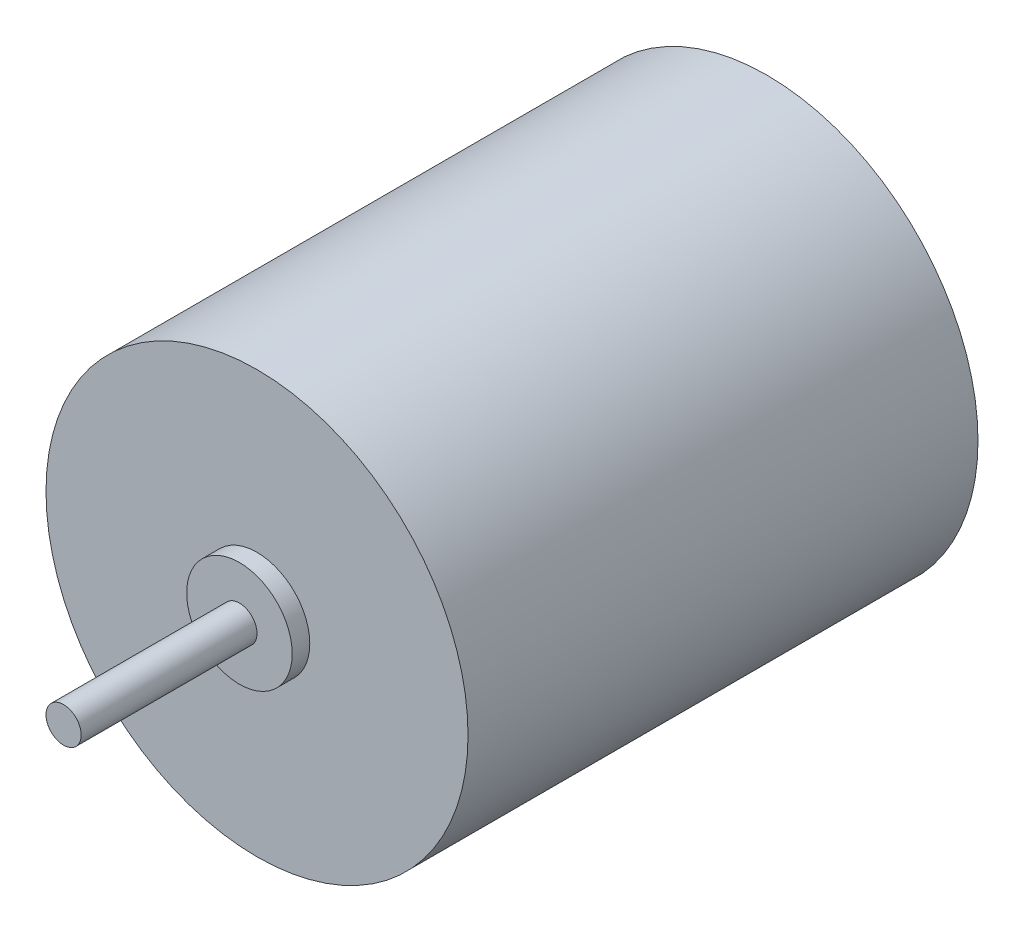
from build123d import *

# Parameters (mm, degrees)
SKETCH1_R           = 12
BOSS_EXTRUDE1_DEPTH = 29
SKETCH2_R           = 3
BOSS_EXTRUDE2_DEPTH = 1
SKETCH3_R           = 1
BOSS_EXTRUDE3_DEPTH = 10


with BuildPart() as part:
    # Sketch1 → Boss-Extrude1 (new body)
    with BuildSketch(Plane.XY):
        Circle(SKETCH1_R)
    extrude(amount=BOSS_EXTRUDE1_DEPTH)

    # Sketch2 → Boss-Extrude2 (add)
    with BuildSketch(Plane.XY.offset(29)):
        Circle(SKETCH2_R)
    extrude(amount=BOSS_EXTRUDE2_DEPTH)

    # Sketch3 → Boss-Extrude3 (add)
    with BuildSketch(Plane.XY.offset(30)):
        Circle(SKETCH3_R)
    extrude(amount=BOSS_EXTRUDE3_DEPTH)


solid = part.part
